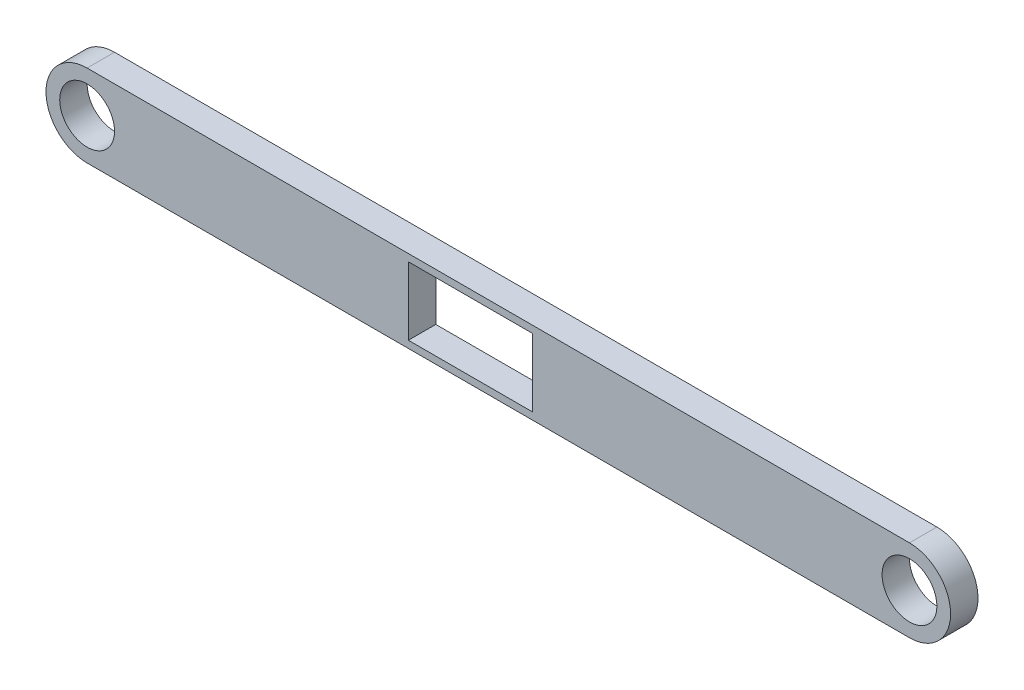
from build123d import *

# Parameters (mm, degrees)
SKETCH1_R           = 5
SKETCH1_W           = 22.6
SKETCH1_H           = 12.4
BOSS_EXTRUDE1_DEPTH = 5


with BuildPart() as part:
    # Sketch1 → Boss-Extrude1 (new body)
    with BuildSketch(Plane.XY):
        with BuildLine():
            Line((75, -7.5), (-75, -7.5))
            ThreePointArc((-75, -7.5), (-82.5, 0), (-75, 7.5))
            Line((-75, 7.5), (75, 7.5))
            ThreePointArc((75, 7.5), (82.5, 0), (75, -7.5))
        make_face()
        with Locations((75, 0)):
            Circle(SKETCH1_R, mode=Mode.SUBTRACT)
        with Locations((-75, 0)):
            Circle(SKETCH1_R, mode=Mode.SUBTRACT)
        with Locations((-5.1, 0)):
            Rectangle(SKETCH1_W, SKETCH1_H, mode=Mode.SUBTRACT)
    extrude(amount=BOSS_EXTRUDE1_DEPTH)


solid = part.part
